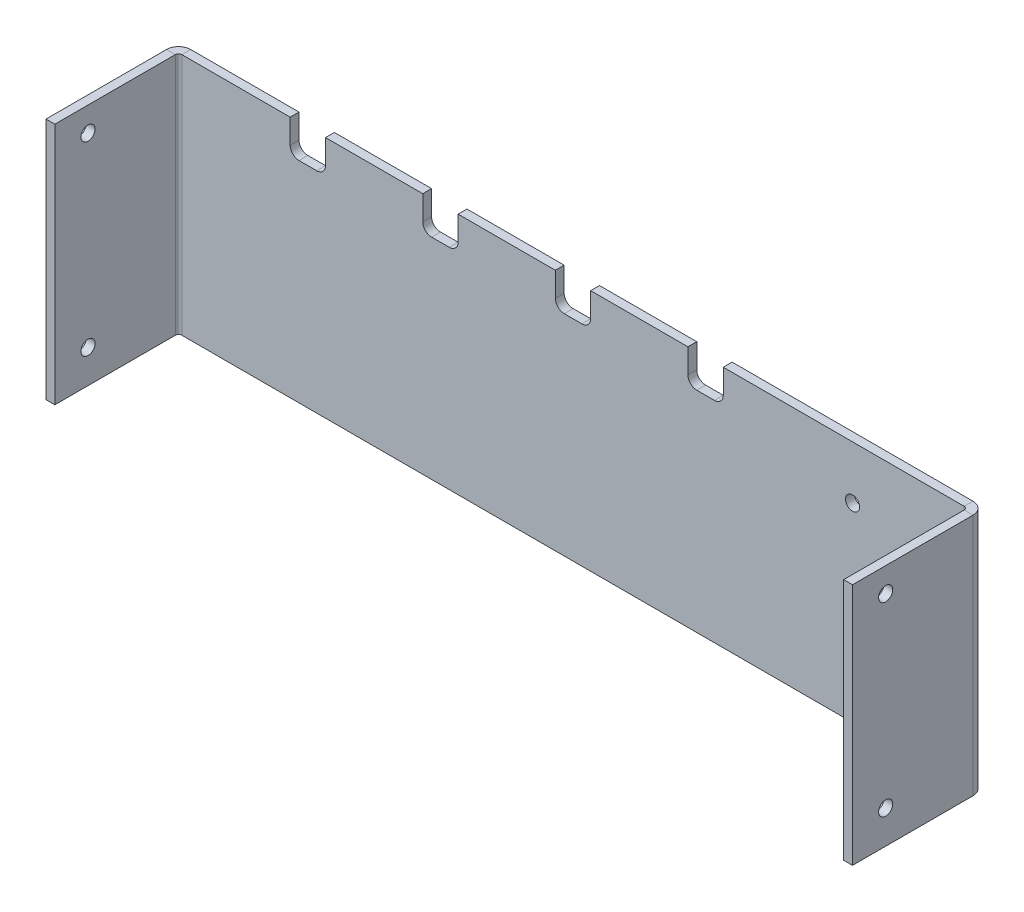
from build123d import *

# Parameters (mm, degrees)
SKETCH_1_W                         = 182.5
SKETCH_1_H                         = 55
SM_BASE_FLANGE_1_DEPTH             = 2
SM_EDGE_FLANGE_1_STRIP_W           = 9.4732
SM_EDGE_FLANGE_1_STRIP_H           = 2
SM_EDGE_FLANGE_1_STRIP_CUT_DEPTH   = 55
SM_EDGE_FLANGE_1_STRIP_2_W         = 9.4732
SM_EDGE_FLANGE_1_STRIP_2_H         = 2
SM_EDGE_FLANGE_1_STRIP_CUT_2_DEPTH = 55
SM_EDGE_FLANGE_1_DEPTH             = 55
SM_EDGE_FLANGE_1_BEND_DEPTH        = 55
SKETCH_12_W                        = 8
SKETCH_12_H                        = 7.5
CUT_EXTRUDE_1_DEPTH                = 10
FILLET_1_R                         = 2
SKETCH_13_R                        = 1.6
CUT_EXTRUDE_2_DEPTH                = 197
SKETCH_14_R                        = 1.6
CUT_EXTRUDE_3_DEPTH                = 10


# Sheet-metal steps are written as plain solids
with BuildPart() as part:
    # Sketch 1 → Базовая кромка1 (new body)
    with BuildSketch(Plane.XY):
        Rectangle(SKETCH_1_W, SKETCH_1_H)
    extrude(amount=-SM_BASE_FLANGE_1_DEPTH)

    # Ребро-кромка1 strip (across the edge) → Ребро-кромка1 strip cut (cut)
    with BuildSketch(Plane(origin=(-91.25, 27.5, 0), x_dir=(1, 0, 0), z_dir=(0, -1, 0))):
        with Locations((-2, -1)):
            Rectangle(SM_EDGE_FLANGE_1_STRIP_W, SM_EDGE_FLANGE_1_STRIP_H)
    extrude(amount=SM_EDGE_FLANGE_1_STRIP_CUT_DEPTH, mode=Mode.SUBTRACT)

    # Ребро-кромка1 strip 2 (across the edge) → Ребро-кромка1 strip cut 2 (cut)
    with BuildSketch(Plane(origin=(91.25, -27.5, 0), x_dir=(-1, 0, 0), z_dir=(0, 1, 0))):
        with Locations((-2, -1)):
            Rectangle(SM_EDGE_FLANGE_1_STRIP_2_W, SM_EDGE_FLANGE_1_STRIP_2_H)
    extrude(amount=SM_EDGE_FLANGE_1_STRIP_CUT_2_DEPTH, mode=Mode.SUBTRACT)

    # Ребро-кромка1 section (across the edge) → Ребро-кромка1 (add)
    with BuildSketch(Plane(origin=(-91.25, 27.5, 0), x_dir=(1, 0, 0), z_dir=(0, -1, 0))):
        with BuildLine():
            Line((0, 0.7366), (0, 28))
            Line((0, 28), (2, 28))
            Line((2, 28), (2, 0.7366))
            ThreePointArc((2, 0.7366), (2.215745145, 0.215745145), (2.7366, 0))
            Line((2.7366, 0), (2.7366, -2))
            ThreePointArc((2.7366, -2), (0.801531583, -1.198468417), (0, 0.7366))
        make_face()
    extrude(amount=SM_EDGE_FLANGE_1_DEPTH)

    # Ребро-кромка1 section 2 (across the edge) → Ребро-кромка1 bend (add)
    with BuildSketch(Plane(origin=(91.25, -27.5, 0), x_dir=(-1, 0, 0), z_dir=(0, 1, 0))):
        with BuildLine():
            Line((0, 0.7366), (0, 28))
            Line((0, 28), (2, 28))
            Line((2, 28), (2, 0.7366))
            ThreePointArc((2, 0.7366), (2.215745145, 0.215745145), (2.7366, 0))
            Line((2.7366, 0), (2.7366, -2))
            ThreePointArc((2.7366, -2), (0.801531583, -1.198468417), (0, 0.7366))
        make_face()
    extrude(amount=SM_EDGE_FLANGE_1_BEND_DEPTH)

    # Эскиз12 → Вырез-Вытянуть1 (cut)
    with BuildSketch(Plane.XY):
        with Locations((0, 23.75)):
            Rectangle(SKETCH_12_W, SKETCH_12_H)
        with Locations((30, 23.75)):
            Rectangle(SKETCH_12_W, SKETCH_12_H)
        with Locations((-30, 23.75)):
            Rectangle(SKETCH_12_W, SKETCH_12_H)
        with Locations((-60, 23.75)):
            Rectangle(SKETCH_12_W, SKETCH_12_H)
    extrude(amount=-CUT_EXTRUDE_1_DEPTH, mode=Mode.SUBTRACT)

    # Скругление1
    fillet_1_edges = [part.edges().sort_by_distance(p)[0] for p in [
        (-56, 20, -1),
        (-64, 20, -1),
        (-26, 20, -1),
        (-34, 20, -1),
        (34, 20, -1),
        (26, 20, -1),
        (4, 20, -1),
        (-4, 20, -1),
    ]]
    fillet(fillet_1_edges, radius=FILLET_1_R)

    # Эскиз13 → Вырез-Вытянуть2 (cut)
    with BuildSketch(Plane(origin=(91.25, 0, 0), x_dir=(0, 0, -1), z_dir=(1, 0, 0))):
        with Locations((-20.5, -20)):
            Circle(SKETCH_13_R)
        with Locations((-20.5, 22)):
            Circle(SKETCH_13_R)
    extrude(amount=-CUT_EXTRUDE_2_DEPTH, mode=Mode.SUBTRACT)

    # Эскиз14 → Вырез-Вытянуть3 (cut)
    with BuildSketch(Plane(origin=(0, 0, -2), x_dir=(-1, 0, 0), z_dir=(0, 0, -1))):
        with Locations((-63.25, 15.5)):
            Circle(SKETCH_14_R)
        with Locations((-63.25, -9.5)):
            Circle(SKETCH_14_R)
    extrude(amount=-CUT_EXTRUDE_3_DEPTH, mode=Mode.SUBTRACT)


solid = part.part
